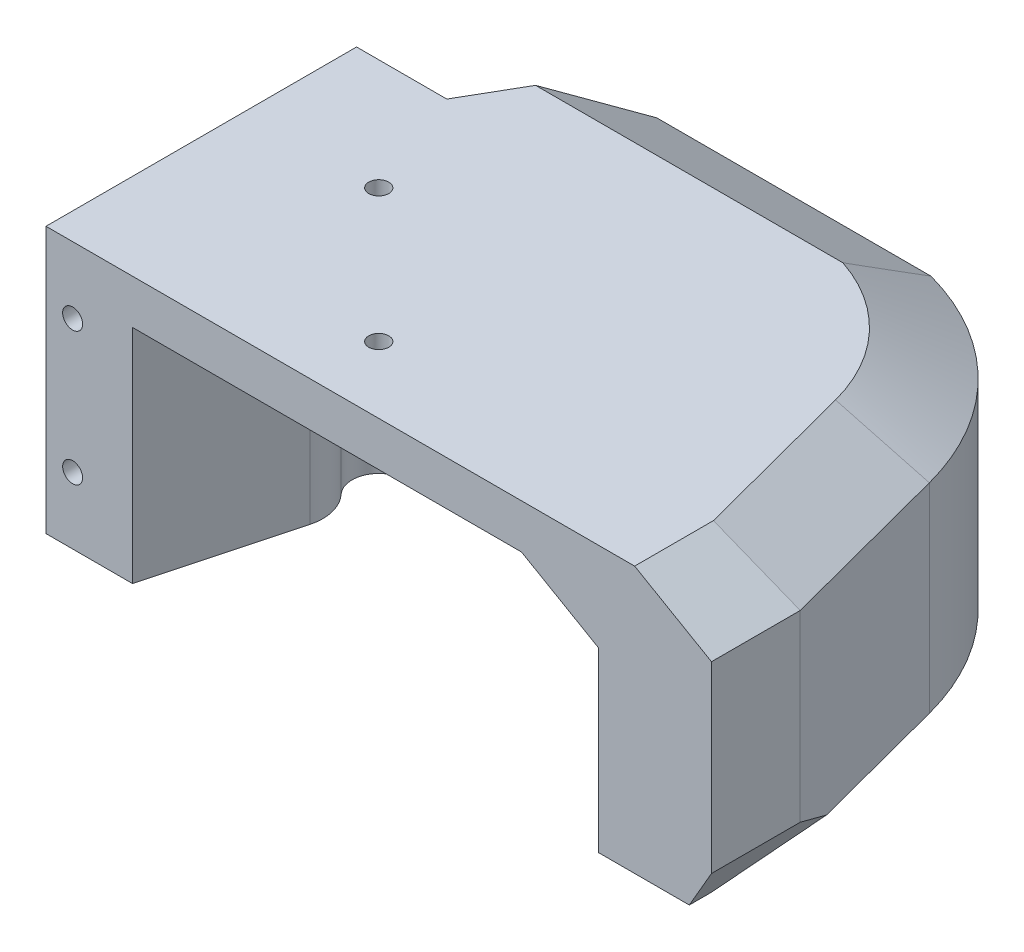
from build123d import *
from OCP.BRepFilletAPI import BRepFilletAPI_MakeChamfer

# Parameters (mm, degrees)
SKETCH_1_W                = 150
SKETCH_1_H                = 60
EXTRUDE_1_DEPTH           = 100
SKETCH_5_R                = 2.25
CUT_EXTRUDE_5_DEPTH       = 191
CUT_EXTRUDE_7_DEPTH       = 50
CUT_EXTRUDE_8_DEPTH       = 191
SKETCH_10_R               = 2.25
CUT_EXTRUDE_9_DEPTH       = 191
SKETCH_11_R               = 6
CUT_EXTRUDE_10_DEPTH      = 50
FILLET_1_R                = 10
CHAMFER_2_SIZE            = 10
CHAMFER_2_SIZE_2          = 17.320508076
CHAMFER_4_SIZE            = 5
CHAMFER_4_SIZE2           = 8.660254038
CUT_EXTRUDE_11_DEPTH      = 10
CUT_EXTRUDE_11_DEPTH_BACK = 3
SKETCH_12_R               = 4.5


with BuildPart() as part:
    # 草图1 → 凸台-拉伸1 (new body)
    with BuildSketch(Plane.XY):
        with Locations((75, 30)):
            Rectangle(SKETCH_1_W, SKETCH_1_H)
    extrude(amount=EXTRUDE_1_DEPTH)

    # 草图5 → 切除-拉伸5 (cut, through all)
    with BuildSketch(Plane.XY.offset(100)):
        with Locations((6, 45)):
            Circle(SKETCH_5_R)
        with Locations((6, 15)):
            Circle(SKETCH_5_R)
    extrude(amount=-CUT_EXTRUDE_5_DEPTH, mode=Mode.SUBTRACT)

    # 草图8 → 切除-拉伸7 (cut)
    with BuildSketch(Plane.XZ):
        with BuildLine():
            Line((124.5, 55), (124.5, 100))
            Line((124.5, 100), (19.5, 100))
            Line((19.5, 100), (35.436672603, 40.523528143))
            Line((35.436672603, 40.523528143), (61.556942546, 22.233918228))
            ThreePointArc((61.556942546, 22.233918228), (102.969944529, 19.519566673), (124.5, 55))
        make_face()
    extrude(amount=-CUT_EXTRUDE_7_DEPTH, mode=Mode.SUBTRACT)

    # 草图9 → 切除-拉伸8 (cut, through all)
    with BuildSketch(Plane.XZ):
        with BuildLine():
            Line((150, 80), (150, 0))
            Line((150, 0), (99.466629547, 0))
            ThreePointArc((99.466629547, 0), (124.98259213, 14.873204284), (139.629974877, 40.519465822))
            Line((139.629974877, 40.519465822), (150, 80))
        make_face()
        Polygon((19.621472223, 30), (27.659947996, 0), (0, 0), (0, 30), align=None)
    extrude(amount=-CUT_EXTRUDE_8_DEPTH, mode=Mode.SUBTRACT)

    # 草图10 → 切除-拉伸9 (cut, through all)
    with BuildSketch(Plane(origin=(0, 60, 0), x_dir=(1, 0, 0), z_dir=(0, 1, 0))):
        with Locations(Location((30, -55, 0), (0, 0, 270))):
            Circle(SKETCH_10_R)
        with Locations(Location((60, -85, 0), (0, 0, 270))):
            Circle(SKETCH_10_R)
    extrude(amount=-CUT_EXTRUDE_9_DEPTH, mode=Mode.SUBTRACT)

    # 草图11 → 切除-拉伸10 (cut)
    with BuildSketch(Plane.XZ):
        with Locations((30, 55)):
            Circle(SKETCH_11_R)
    extrude(amount=-CUT_EXTRUDE_10_DEPTH, mode=Mode.SUBTRACT)

    # 圆角1
    fillet_1_edges = [part.edges().sort_by_distance(p)[0] for p in [
        (32.956659097, 25, 49.779064549),
        (29.950074163, 25, 60.999792281),
    ]]
    fillet(fillet_1_edges, radius=FILLET_1_R)

    # 倒角2
    # the kernel refuses this chamfer: 17.320508076, 10 mm, written as the material it adds along each edge
    with BuildSketch(Plane(origin=(-1.269235366, 50, 66.225281599), x_dir=(-0.0332065552835215, -0.9983227437537926, -0.04742387573893358), z_dir=(0.8191520442889948, 0, -0.5735764363510419))) as chamfer_2_piece_1_section:
        Polygon((CHAMFER_2_SIZE * 0.998322743754, -CHAMFER_2_SIZE * 0.0578938624027), (-CHAMFER_2_SIZE_2 * 0.0578938624016, -CHAMFER_2_SIZE_2 * 0.998322743736), (0, 0), align=None)
    chamfer_2_piece_1 = extrude(amount=76.696601504, mode=Mode.PRIVATE)
    chamfer_2_piece_1 = split(chamfer_2_piece_1, bisect_by=Plane(origin=(0, 46.853516386, 53.66836115), z_dir=(1, 0, 0)), keep=Keep.TOP, mode=Mode.PRIVATE)
    chamfer_2_piece_1 = chamfer_2_piece_1 - Plane(origin=(6, 45, 53.66836115), x_dir=(1, 0, 0), z_dir=(0, 0, 1)) * Cylinder(2.25, 223, mode=Mode.PRIVATE)
    chamfer_2_piece_1 = chamfer_2_piece_1 - Plane(origin=(30, 46.853516386, 55), x_dir=(0, 0, 1), z_dir=(0, 1, 0)) * Cylinder(2.25, 223, mode=Mode.PRIVATE)
    add(chamfer_2_piece_1)
    with BuildSketch(Plane(origin=(124.5, 50, 55), x_dir=(0.05789386240267183, -0.9983227437537926, 0), z_dir=(0, 0, 1))) as chamfer_2_piece_2:
        Polygon((CHAMFER_2_SIZE * 0.998322743754, -CHAMFER_2_SIZE * 0.0578938624027), (-CHAMFER_2_SIZE_2 * 0.0578938624016, -CHAMFER_2_SIZE_2 * 0.998322743736), (0, 0), align=None)
    extrude(amount=45)
    with BuildSketch(Plane(origin=(84.5, 50, 55), x_dir=(-0.5735764363510413, 0, -0.8191520442889951), z_dir=(-0.8191520442889951, 0, 0.5735764363510413))) as chamfer_2_piece_3:
        Polygon((40, CHAMFER_2_SIZE), (40 - CHAMFER_2_SIZE_2, 0), (40, 0), align=None)
    revolve(axis=Axis((84.5, 50, 55), (0, -1, 0)), revolution_arc=125)

    # 倒角3
    # the kernel refuses this chamfer: 33.46065215, 17.320508076, 10 mm, written as the material it takes off along each edge
    with BuildSketch(Plane(origin=(27.659947996, -34.755198876, 0), x_dir=(-0.2684337130154822, 0, 0.9632981582649901), z_dir=(0, 1, 0))) as chamfer_3_piece_1_section:
        with BuildLine():
            Line((34.755198876, 0), (-3.980545955, 9.966488807))
            Line((-3.980545955, 9.966488807), (-4.625197647, 9.786849465))
            ThreePointArc((-4.625197647, 9.786849465), (-2.076639928, 4.959177295), (-0.644651692, -0.179639342))
            Line((-0.644651692, -0.179639342), (0.006670144, -0.669179801))
            ThreePointArc((0.006670144, -0.669179801), (17.382543222, -0.495983324), (34.76186902, -0.669179801))
            Line((34.76186902, -0.669179801), (34.755198876, 0))
        make_face()
    chamfer_3_piece_1 = extrude(amount=129.510397752, mode=Mode.PRIVATE)
    chamfer_3_piece_1 = split(chamfer_3_piece_1, bisect_by=Plane(origin=(27.837157989, 30, 30), z_dir=(0, 0, -1)), keep=Keep.TOP, mode=Mode.PRIVATE)
    add(chamfer_3_piece_1, mode=Mode.SUBTRACT)
    with BuildSketch(Plane(origin=(139.629974877, 60, 40.519465822), x_dir=(0.05599451192610632, -0.9983227437537928, -0.014707614968315207), z_dir=(0.2540444592557946, 0, 0.9671925417006848))) as chamfer_3_piece_2:
        with BuildLine():
            Line((10.363792898, 0), (-1.383316572, -17.870395769))
            Line((-1.383316572, -17.870395769), (-1.729145715, -17.850340747))
            ThreePointArc((-1.729145715, -17.850340747), (-0.864572857, -8.925170374), (-0.345829143, 0.020055022))
            Line((-0.345829143, 0.020055022), (0.020055022, 0.345829143))
            ThreePointArc((0.020055022, 0.345829143), (5.184583312, 0.04633232), (10.38384792, 0.345829143))
            Line((10.38384792, 0.345829143), (10.363792898, 0))
        make_face()
    extrude(amount=58.743581506, mode=Mode.SUBTRACT)
    with BuildSketch(Plane(origin=(84.5, 60, 55), x_dir=(-0.0488032324708506, 0, -0.9988084123095861), z_dir=(-0.9988084123095861, 0, 0.0488032324708506))) as chamfer_3_piece_3:
        with BuildLine():
            Line((57.6, 10.346410162), (39.079491924, -0.346410162))
            Line((39.079491924, -0.346410162), (39.079491924, -0.692820323))
            ThreePointArc((39.079491924, -0.692820323), (48.039745962, -0.346410162), (57, -0.346410162))
            Line((57, -0.346410162), (57.346410162, 0))
            ThreePointArc((57.346410162, 0), (57.346410162, 5.173205081), (57.946410162, 10.346410162))
            Line((57.946410162, 10.346410162), (57.6, 10.346410162))
        make_face()
    revolve(axis=Axis((84.5, 60, 55), (0, -1, 0)), revolution_arc=78.080358164, mode=Mode.SUBTRACT)
    with BuildSketch(Plane(origin=(150, 60, 62.076144118), x_dir=(0.057893862402670464, -0.9983227437537926, 0), z_dir=(0, 0, 1))) as chamfer_3_piece_4:
        with BuildLine():
            Line((10.363792898, 0), (-1.383316572, -17.870395769))
            Line((-1.383316572, -17.870395769), (-1.729145715, -17.850340747))
            ThreePointArc((-1.729145715, -17.850340747), (-0.864572857, -8.925170374), (-0.345829143, 0.020055022))
            Line((-0.345829143, 0.020055022), (0.020055022, 0.345829143))
            ThreePointArc((0.020055022, 0.345829143), (5.184583312, 0.04633232), (10.38384792, 0.345829143))
            Line((10.38384792, 0.345829143), (10.363792898, 0))
        make_face()
    extrude(amount=55.847711765, mode=Mode.SUBTRACT)
    # the kernel refuses this chamfer: 33.46065215, 17.320508076, 10 mm, written as the material it takes off along each edge
    with BuildSketch(Plane(origin=(99.736475847, 60, 0), x_dir=(0, -0.9983227437537926, -0.05789386240267141), z_dir=(-1, 0, 0))) as chamfer_3_2_piece_1:
        with BuildLine():
            Line((10.363792898, 0), (-1.383316572, 17.870395769))
            Line((-1.383316572, 17.870395769), (-1.729145715, 17.850340747))
            ThreePointArc((-1.729145715, 17.850340747), (-0.864572857, 8.925170374), (-0.345829143, -0.020055022))
            Line((-0.345829143, -0.020055022), (0.020055022, -0.345829143))
            ThreePointArc((0.020055022, -0.345829143), (5.184583312, -0.04633232), (10.38384792, -0.345829143))
            Line((10.38384792, -0.345829143), (10.363792898, 0))
        make_face()
    extrude(amount=80.000383734, mode=Mode.SUBTRACT)

    # 倒角4: one chamfer whose edges measure the first distance from different faces: ONE call of the kernel's chamfer builder (chamfer() names one face for all edges)
    chamfer_4_edges_1 = [part.edges().sort_by_distance(p)[0] for p in [
        (68.563288771, 0, 0),
    ]]
    chamfer_4_side_1 = [part.faces().sort_by_distance(p)[0] for p in [
        (68.563288771, 25, 0),
    ]]
    chamfer_4_edges_2 = [part.edges().sort_by_distance(p)[0] for p in [
        (124.98259213, 0, 14.873204284),
    ]]
    chamfer_4_side_2 = [part.faces().sort_by_distance(p)[0] for p in [
        (124.98259213, 25, 14.873204284),
    ]]
    chamfer_4_edges_3 = [part.edges().sort_by_distance(p)[0] for p in [
        (144.814987438, 0, 60.259732911),
    ]]
    chamfer_4_side_3 = [part.faces().sort_by_distance(p)[0] for p in [
        (144.814987438, 25, 60.259732911),
    ]]
    chamfer_4_edges_4 = [part.edges().sort_by_distance(p)[0] for p in [
        (150, 0, 90),
    ]]
    chamfer_4_side_4 = [part.faces().sort_by_distance(p)[0] for p in [
        (31.203351809, 0, 45.395528881),
    ]]
    chamfer_4 = BRepFilletAPI_MakeChamfer(part.part.solid().wrapped)
    for e in chamfer_4_edges_1:
        chamfer_4.Add(CHAMFER_4_SIZE, CHAMFER_4_SIZE2, e.wrapped, chamfer_4_side_1[0].wrapped)  # the first distance lies on this face
    for e in chamfer_4_edges_2:
        chamfer_4.Add(CHAMFER_4_SIZE, CHAMFER_4_SIZE2, e.wrapped, chamfer_4_side_2[0].wrapped)  # the first distance lies on this face
    for e in chamfer_4_edges_3:
        chamfer_4.Add(CHAMFER_4_SIZE, CHAMFER_4_SIZE2, e.wrapped, chamfer_4_side_3[0].wrapped)  # the first distance lies on this face
    for e in chamfer_4_edges_4:
        chamfer_4.Add(CHAMFER_4_SIZE, CHAMFER_4_SIZE2, e.wrapped, chamfer_4_side_4[0].wrapped)  # the first distance lies on this face
    add(Compound.cast(chamfer_4.Shape()), mode=Mode.REPLACE)

    # 草图12 → 切除-拉伸11 (cut, two sides: drawn at the far end of the back side and taken through both)
    with BuildSketch(Plane.XZ.offset(-50).offset(-CUT_EXTRUDE_11_DEPTH_BACK)):
        with Locations(Location((30, 55, 0), (0, 0, 55))):
            Circle(SKETCH_12_R)
        with Locations(Location((60, 85, 0), (0, 0, 270))):
            Circle(SKETCH_12_R)
    extrude(amount=CUT_EXTRUDE_11_DEPTH + CUT_EXTRUDE_11_DEPTH_BACK, mode=Mode.SUBTRACT)


solid = part.part
